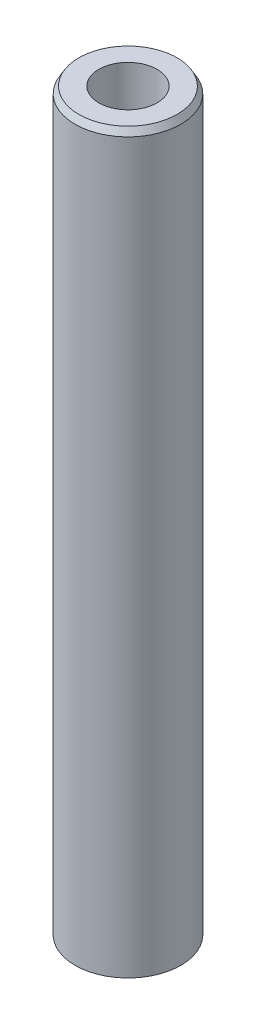
from build123d import *
from OCP.BRepFilletAPI import BRepFilletAPI_MakeChamfer

# Parameters (mm, degrees)
SKETCH1_R           = 20
BOSS_EXTRUDE1_DEPTH = 279.242839233
SKETCH2_R           = 10.999145439
CUT_EXTRUDE1_DEPTH  = 281.671628888
CHAMFER1_SIZE       = 2.493068271
CHAMFER1_SIZE2      = 1.439373637


with BuildPart() as part:
    # Sketch1 → Boss-Extrude1 (new body)
    with BuildSketch(Plane(origin=(0, 0, 0), x_dir=(1, 0, 0), z_dir=(0, 1, 0))):
        Circle(SKETCH1_R)
    extrude(amount=BOSS_EXTRUDE1_DEPTH)

    # Sketch2 → Cut-Extrude1 (cut, through all)
    with BuildSketch(Plane(origin=(0, 0, 0), x_dir=(1, 0, 0), z_dir=(0, 1, 0))):
        Circle(SKETCH2_R)
    extrude(amount=CUT_EXTRUDE1_DEPTH, mode=Mode.SUBTRACT)

    # Chamfer1: one chamfer whose edges measure the first distance from different faces: ONE call of the kernel's chamfer builder (chamfer() names one face for all edges)
    chamfer1_edges_1 = [part.edges().sort_by_distance(p)[0] for p in [
        (-20, 279.242839233, 0),
    ]]
    chamfer1_side_1 = [part.faces().sort_by_distance(p)[0] for p in [
        (-20, 139.621419616, 0),
    ]]
    chamfer1_edges_2 = [part.edges().sort_by_distance(p)[0] for p in [
        (-20, 0, 0),
    ]]
    chamfer1_side_2 = [part.faces().sort_by_distance(p)[0] for p in [
        (-19.434314575, 0, 0),
    ]]
    chamfer1 = BRepFilletAPI_MakeChamfer(part.part.solid().wrapped)
    for e in chamfer1_edges_1:
        chamfer1.Add(CHAMFER1_SIZE, CHAMFER1_SIZE2, e.wrapped, chamfer1_side_1[0].wrapped)  # the first distance lies on this face
    for e in chamfer1_edges_2:
        chamfer1.Add(CHAMFER1_SIZE, CHAMFER1_SIZE2, e.wrapped, chamfer1_side_2[0].wrapped)  # the first distance lies on this face
    add(Compound.cast(chamfer1.Shape()), mode=Mode.REPLACE)


solid = part.part
